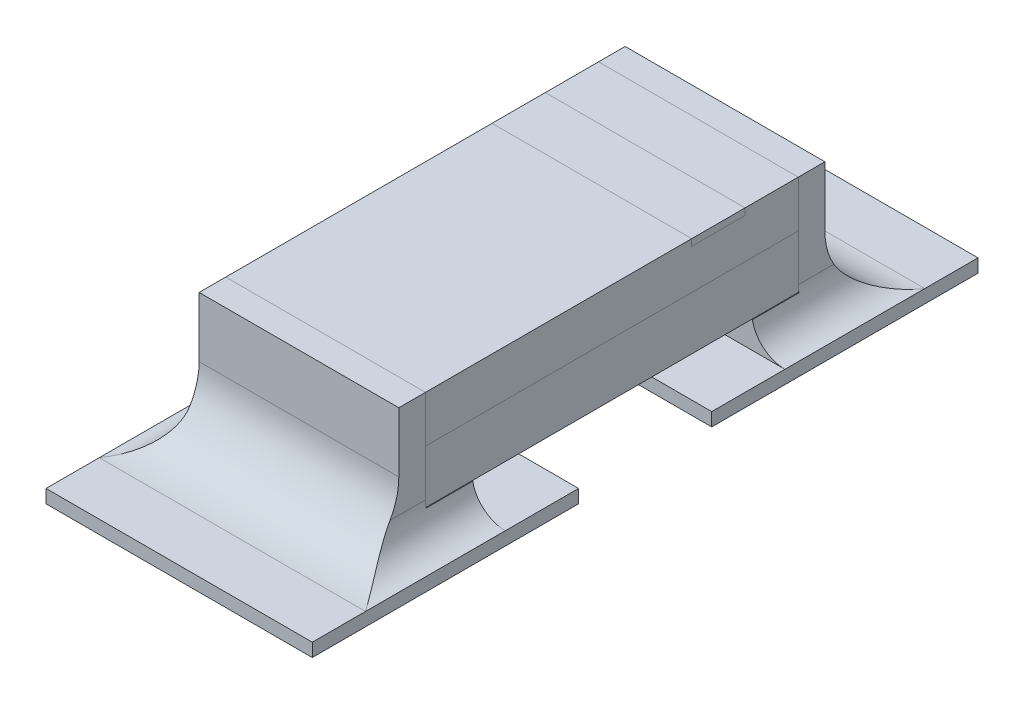
from build123d import *

# Parameters (mm, degrees)
SKETCH1_W           = 1.5
SKETCH1_H           = 0.4
BOSS_EXTRUDE1_DEPTH = 1.4
BOSS_EXTRUDE2_DEPTH = 0.75
SKETCH3_W           = 1.5
SKETCH3_H           = 2.8
BOSS_EXTRUDE3_DEPTH = 0.35
SKETCH4_W           = 2
SKETCH4_H           = 2
BOSS_EXTRUDE4_DEPTH = 0.1
SKETCH5_W           = 1.5
SKETCH5_H           = 0.4
CUT_EXTRUDE1_DEPTH  = 0.05
SKETCH5_2_W         = 1.5
SKETCH5_2_H         = 0.4
BOSS_EXTRUDE5_DEPTH = 0.05
FILLET1_R           = 0.5
FILLET2_START       = 1.05
FILLET2_DEPTH       = 0.5499999
FILLET2_START_2     = 1.5999999
FILLET2_2_DEPTH     = 0.5000001
FILLET2_START_3     = -2
FILLET2_3_OUTLINE_W = 0.05
FILLET2_3_OUTLINE_H = 0.35
FILLET2_3_DEPTH     = 4


with BuildPart() as part:
    # Sketch1 → Boss-Extrude1 (new, symmetric)
    with BuildSketch(Plane.XY):
        with Locations((0, 0.3)):
            Rectangle(SKETCH1_W, SKETCH1_H)
    extrude(amount=BOSS_EXTRUDE1_DEPTH, both=True)


with BuildPart() as body_2:
    # Sketch2 → Boss-Extrude2 (new, symmetric)
    with BuildSketch(Plane(origin=(0, 0, 0), x_dir=(0, 0, -1), z_dir=(1, 0, 0))):
        Polygon((-1.6, 0.85), (-1.4, 0.85), (-1.4, 0.1), (-1.05, 0.1), (-1.05, -0.1), (-1.6, -0.1), align=None)
    extrude(amount=BOSS_EXTRUDE2_DEPTH, both=True)

    # Sketch4 → Boss-Extrude4 (add)
    with BuildSketch(Plane.XZ.offset(0.1)):
        with Locations((0, 1.5)):
            Rectangle(SKETCH4_W, SKETCH4_H)
    extrude(amount=BOSS_EXTRUDE4_DEPTH)

    # Fillet1
    fillet1_edges = [body_2.edges().sort_by_distance(p)[0] for p in [
        (0, -0.1, 1.6),
    ]]
    fillet(fillet1_edges, radius=FILLET1_R)

    # Fillet2: read off the stored shape, not the designer's step
    # Fillet2 outline → Fillet2 (add)
    with BuildSketch(Plane.XY.offset(FILLET2_START)):
        with BuildLine():
            Line((-0.75, -0.1), (-0.75, 0.15))
            ThreePointArc((-0.75, 0.15), (-0.823223305, -0.026776695), (-1, -0.1))
            Line((-1, -0.1), (-0.75, -0.1))
        make_face()
        with BuildLine():
            Line((0.75, 0.15), (0.75, -0.1))
            Line((0.75, -0.1), (1, -0.1))
            ThreePointArc((1, -0.1), (0.823223305, -0.026776695), (0.75, 0.15))
        make_face()
    extrude(amount=FILLET2_DEPTH)

    # Fillet2 2 outline → Fillet2 2 (add)
    with BuildSketch(Plane.XY.offset(FILLET2_START_2)):
        with BuildLine():
            Line((-0.75, -0.1), (-0.75, 0.15))
            ThreePointArc((-0.75, 0.15), (-0.823223305, -0.026776695), (-1, -0.1))
            Line((-1, -0.1), (-0.75, -0.1))
        make_face()
        with BuildLine():
            Line((0.75, 0.15), (0.75, -0.1))
            Line((0.75, -0.1), (1, -0.1))
            ThreePointArc((1, -0.1), (0.823223305, -0.026776695), (0.75, 0.15))
        make_face()
    extrude(amount=FILLET2_2_DEPTH)

    # Fillet2 3 outline → Fillet2 3 (cut)
    with BuildSketch(Plane.YZ.offset(FILLET2_START_3)):
        with BuildLine():
            ThreePointArc((-0.1, 2.1), (-0.033012702, 1.85), (0.15, 1.666987298))
            Line((0.15, 1.666987298), (0.15, 2.1))
            Line((0.15, 2.1), (-0.1, 2.1))
        make_face()
        with Locations((0.125, 1.225)):
            Rectangle(FILLET2_3_OUTLINE_W, FILLET2_3_OUTLINE_H)
    extrude(amount=FILLET2_3_DEPTH, mode=Mode.SUBTRACT)


with BuildPart() as body_3:
    # Sketch3 → Boss-Extrude3 (new body)
    with BuildSketch(Plane(origin=(0, 0.5, 0), x_dir=(1, 0, 0), z_dir=(0, 1, 0))):
        Rectangle(SKETCH3_W, SKETCH3_H)
    extrude(amount=BOSS_EXTRUDE3_DEPTH)

    # Sketch5 → Cut-Extrude1 (cut)
    with BuildSketch(Plane(origin=(0, 0.85, 0), x_dir=(1, 0, 0), z_dir=(0, 1, 0))):
        with Locations((0, 0.8)):
            Rectangle(SKETCH5_W, SKETCH5_H)
    extrude(amount=-CUT_EXTRUDE1_DEPTH, mode=Mode.SUBTRACT)


with BuildPart() as body_4:
    # Sketch5<2> → Boss-Extrude5 (new body)
    with BuildSketch(Plane(origin=(0, 0.85, 0), x_dir=(1, 0, 0), z_dir=(0, 1, 0))):
        with Locations((0, 0.8)):
            Rectangle(SKETCH5_2_W, SKETCH5_2_H)
    extrude(amount=-BOSS_EXTRUDE5_DEPTH)


with BuildPart() as body_5:
    # Mirror1: mirrored copy
    add(body_2.part.mirror(Plane.XY))


solid = Compound([part.part, body_2.part, body_3.part, body_4.part, body_5.part])
